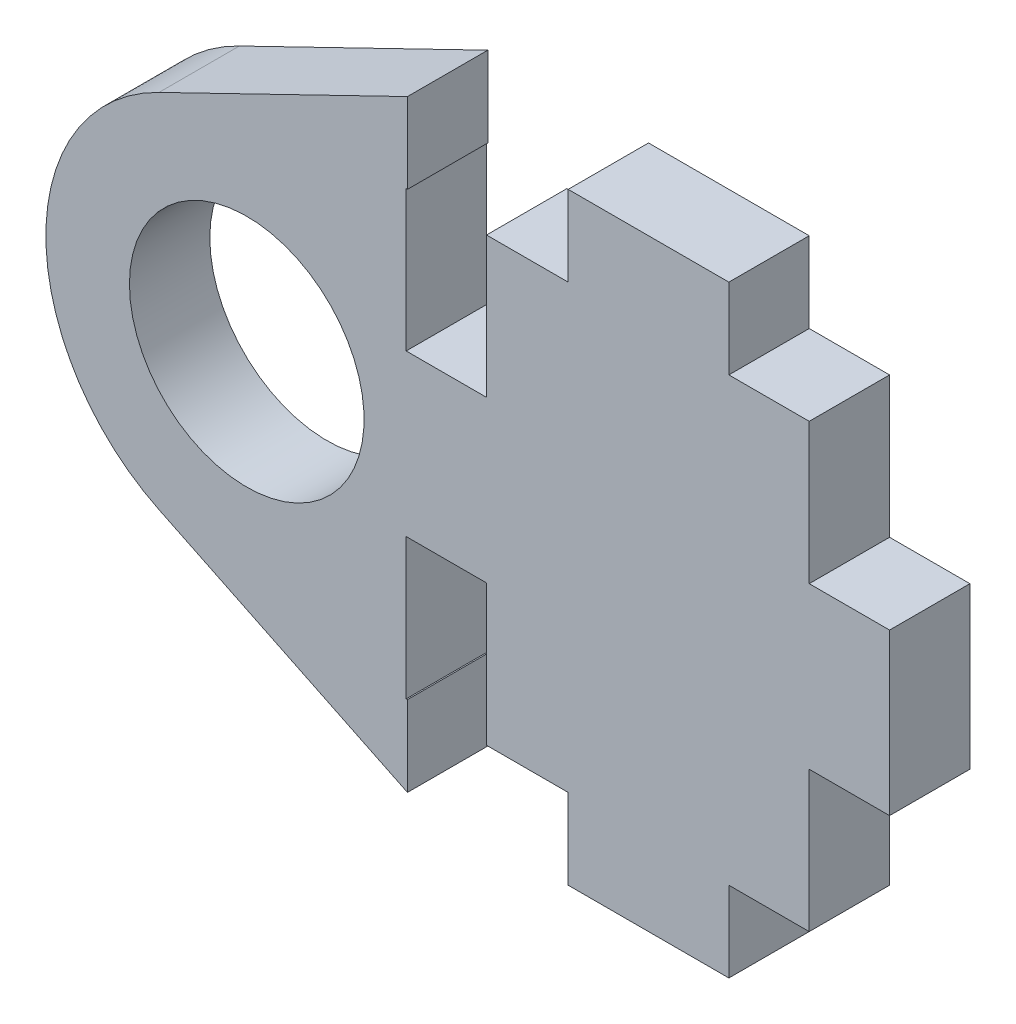
from build123d import *

# Parameters (mm, degrees)
MASS_DEPTH          = 6.35
SKETCH4_R           = 9.271
CUT_EXTRUDE1_DEPTH  = 54.623672769
SKETCH3_W           = 12.7
SKETCH3_H           = 12.7
CUT_EXTRUDE2_DEPTH  = 54.623672769
LPATTERN1_COUNT     = 2
LPATTERN1_PITCH     = 25.4
CAVITY1_START       = -19.1516
CAVITY1_OUTLINE_W   = 11.1125
CAVITY1_OUTLINE_H   = 6.35
CAVITY1_DEPTH       = 6.35
CAVITY1_START_2     = 12.7
CAVITY1_2_OUTLINE_W = 11.1125
CAVITY1_2_OUTLINE_H = 6.35
CAVITY1_2_DEPTH     = 6.35


# Read off the part's stored shape, not the designer's step: Cavity1
with BuildPart() as part:
    # Sketch1 → Mass (new body)
    with BuildSketch(Plane.XY):
        with BuildLine():
            Line((-19.05, -23.8125), (19.05, -23.8125))
            Line((19.05, -23.8125), (19.05, 23.8125))
            Line((19.05, 23.8125), (-19.05, 23.8125))
            Line((-19.05, 23.8125), (-38.68314018, 14.281008096))
            ThreePointArc((-38.68314018, 14.281008096), (-47.625, 0), (-38.68314018, -14.281008096))
            Line((-38.68314018, -14.281008096), (-19.05, -23.8125))
        make_face()
    extrude(amount=MASS_DEPTH)

    # Sketch4 → Cut-Extrude1 (cut, through all)
    with BuildSketch(Plane(origin=(0, 0, 0), x_dir=(-1, 0, 0), z_dir=(0, 0, -1))):
        with Locations((31.75, 0)):
            Circle(SKETCH4_R)
    extrude(amount=-CUT_EXTRUDE1_DEPTH, mode=Mode.SUBTRACT)

    # Sketch3 → Cut-Extrude2 (cut, through all)
    with BuildSketch(Plane(origin=(0, 0, 0), x_dir=(-1, 0, 0), z_dir=(0, 0, -1))):
        with Locations((-12.7, 23.8125)):
            Rectangle(SKETCH3_W, SKETCH3_H)
        with Locations((-12.7, -23.8125)):
            Rectangle(SKETCH3_W, SKETCH3_H)
    cut_extrude2 = extrude(amount=-CUT_EXTRUDE2_DEPTH, mode=Mode.SUBTRACT)

    # LPattern1: Cut-Extrude2 ×2
    with Locations(*[(-i * LPATTERN1_PITCH, 0, 0) for i in range(1, LPATTERN1_COUNT)]):
        add(cut_extrude2, mode=Mode.SUBTRACT)

    # Cavity1 outline → Cavity1 (cut)
    with BuildSketch(Plane.YZ.offset(CAVITY1_START)):
        with Locations((-11.90625, 3.175)):
            Rectangle(CAVITY1_OUTLINE_W, CAVITY1_OUTLINE_H)
        with Locations((11.90625, 3.175)):
            Rectangle(CAVITY1_OUTLINE_W, CAVITY1_OUTLINE_H)
    extrude(amount=CAVITY1_DEPTH, mode=Mode.SUBTRACT)

    # Cavity1 2 outline → Cavity1 2 (cut)
    with BuildSketch(Plane.YZ.offset(CAVITY1_START_2)):
        with Locations((-11.90625, 3.175)):
            Rectangle(CAVITY1_2_OUTLINE_W, CAVITY1_2_OUTLINE_H)
        with Locations((11.90625, 3.175)):
            Rectangle(CAVITY1_2_OUTLINE_W, CAVITY1_2_OUTLINE_H)
    extrude(amount=CAVITY1_2_DEPTH, mode=Mode.SUBTRACT)


solid = part.part
